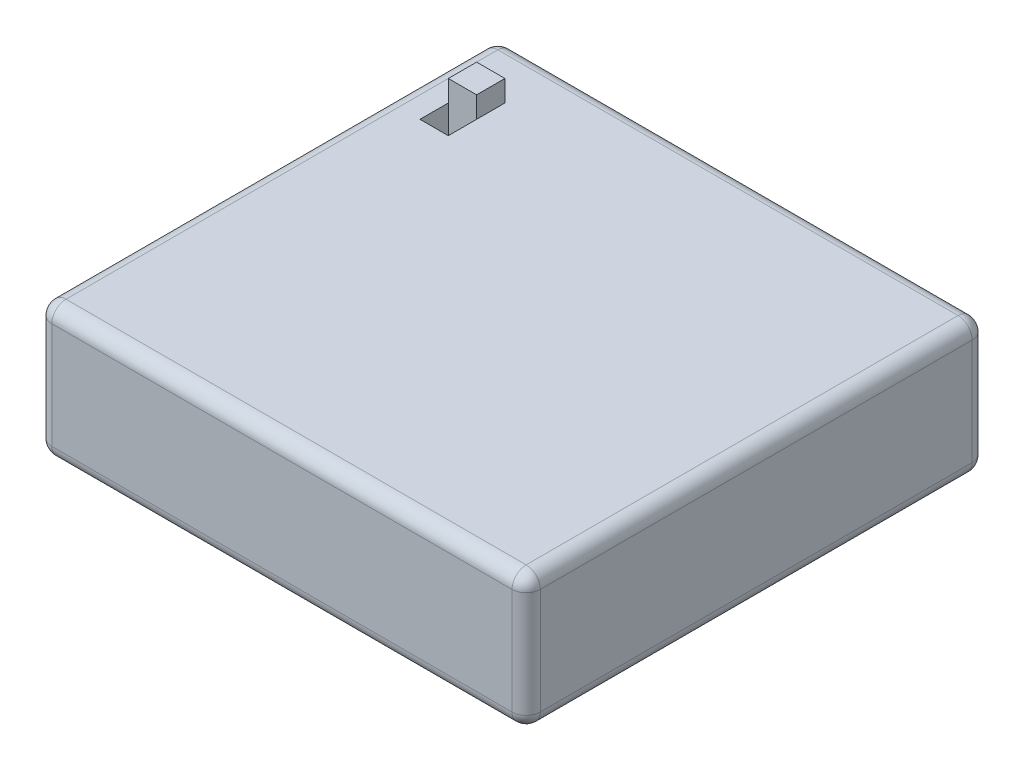
from build123d import *

# Parameters (mm, degrees)
EXTRUDE_1_DEPTH     = 65
FILLET_1_R          = 2
SKETCH_2_W          = 4
SKETCH_2_H          = 8
CUT_EXTRUDE_1_DEPTH = 4
SKETCH_4_W          = 4
SKETCH_4_H          = 4
EXTRUDE_2_DEPTH     = 7
SKETCH_5_R          = 0.5
EXTRUDE_3_DEPTH     = 5


with BuildPart() as part:
    # Эскиз1 → Бобышка-Вытянуть1 (new body)
    with BuildSketch(Plane.XY):
        with BuildLine():
            Line((32.5, -9.5), (-32.5, -9.5))
            ThreePointArc((-32.5, -9.5), (-33.914213562, -8.914213562), (-34.5, -7.5))
            Line((-34.5, -7.5), (-34.5, 7.5))
            ThreePointArc((-34.5, 7.5), (-33.914213562, 8.914213562), (-32.5, 9.5))
            Line((-32.5, 9.5), (32.5, 9.5))
            ThreePointArc((32.5, 9.5), (33.914213562, 8.914213562), (34.5, 7.5))
            Line((34.5, 7.5), (34.5, -7.5))
            ThreePointArc((34.5, -7.5), (33.914213562, -8.914213562), (32.5, -9.5))
        make_face()
    extrude(amount=EXTRUDE_1_DEPTH)

    # Скругление1
    fillet_1_edges = [part.edges().sort_by_distance(p)[0] for p in [
        (33.914213562, 8.914213562, 65),
        (34.5, 0, 65),
        (33.914213562, -8.914213562, 65),
        (0, -9.5, 65),
        (-33.914213562, -8.914213562, 65),
        (-34.5, 0, 65),
        (-33.914213562, 8.914213562, 65),
        (-34.5, 0, 0),
        (-33.914213562, -8.914213562, 0),
        (0, -9.5, 0),
        (33.914213562, -8.914213562, 0),
        (34.5, 0, 0),
        (33.914213562, 8.914213562, 0),
        (-33.914213562, 8.914213562, 0),
        (0, 9.5, 65),
        (0, 9.5, 0),
    ]]
    fillet(fillet_1_edges, radius=FILLET_1_R)

    # Эскиз2 → Вырез-Вытянуть1 (cut)
    with BuildSketch(Plane(origin=(0, 9.5, 0), x_dir=(1, 0, 0), z_dir=(0, 1, 0))):
        with Locations((-27.5, -12)):
            Rectangle(SKETCH_2_W, SKETCH_2_H)
    extrude(amount=-CUT_EXTRUDE_1_DEPTH, mode=Mode.SUBTRACT)

    # Эскиз4 → Бобышка-Вытянуть2 (add)
    with BuildSketch(Plane(origin=(0, 5.5, 0), x_dir=(1, 0, 0), z_dir=(0, 1, 0))):
        with Locations((-27.5, -10)):
            Rectangle(SKETCH_4_W, SKETCH_4_H)
    extrude(amount=EXTRUDE_2_DEPTH)

    # Эскиз5 → Бобышка-Вытянуть3 (add)
    with BuildSketch(Plane.ZY.offset(34.5)):
        with Locations((55, 0)):
            Circle(SKETCH_5_R)
        with Locations((57, 0)):
            Circle(SKETCH_5_R)
    extrude(amount=EXTRUDE_3_DEPTH)


solid = part.part
